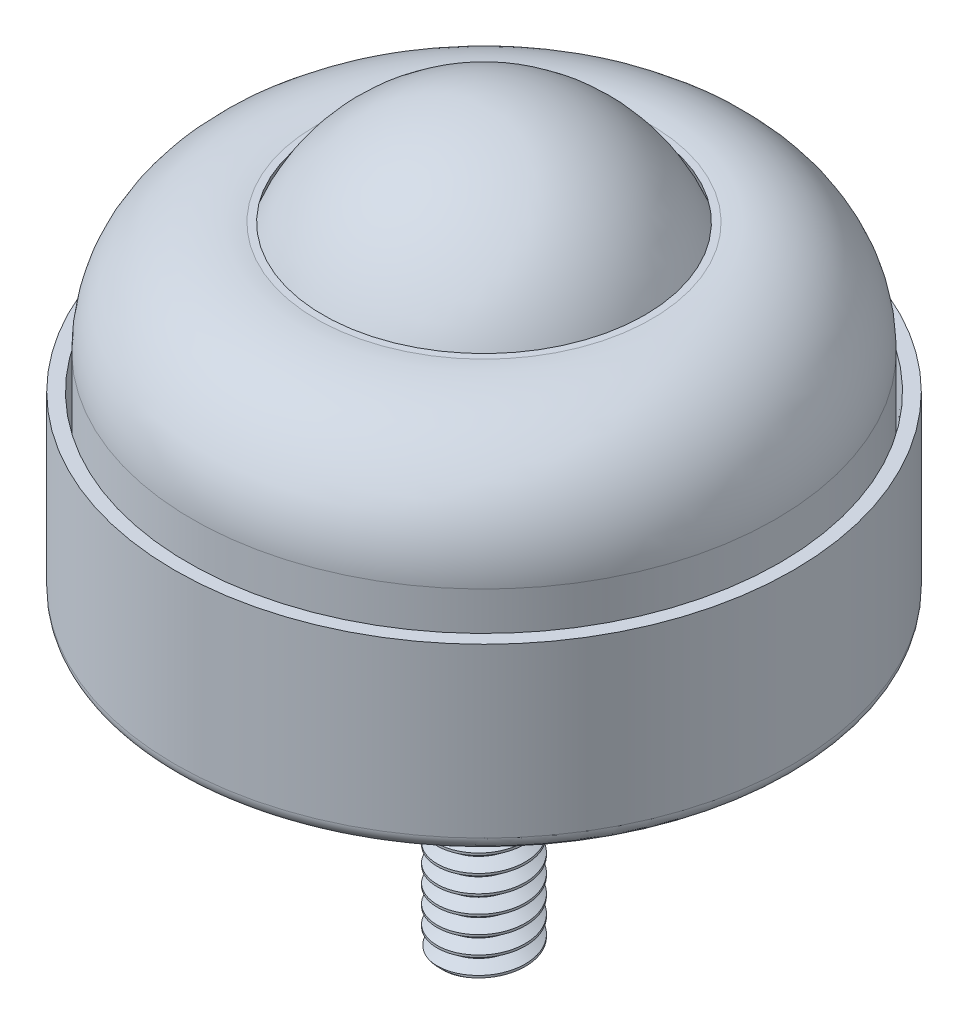
from build123d import *

# Parameters (mm, degrees)
SKETCH4_W           = 7.14375
SKETCH4_H           = 7.14375
CUT_EXTRUDE1_DEPTH  = 0.9525
SKETCH5_W           = 6.57225
SKETCH5_H           = 6.57225
CUT_EXTRUDE2_DEPTH  = 0.9525
FILLET1_R           = 1.524
FILLET2_R           = 0.1905
SKETCH7_W           = 6.35
SKETCH7_H           = 3.4925
BOSS_EXTRUDE1_DEPTH = 3.175
SKETCH8_OUTSIDE_W   = 79.734
SKETCH8_OUTSIDE_H   = 79.734
SKETCH8_OUTSIDE_R   = 4.041115254
CUT_EXTRUDE3_DEPTH  = 47.96712951
CUT_EXTRUDE3_DRAFT  = -10
FILLET3_R           = 0.127
CUT_SWEEP1_PITCH    = 1.27
CUT_SWEEP1_TO       = 17.5


with BuildPart() as part:
    # Sketch3 → Revolve1 (revolve)
    with BuildSketch(Plane.XY, mode=Mode.PRIVATE) as revolve1_sk:
        with BuildLine():
            ThreePointArc((20.955, 19.7485), (18.288003578, 25.737218359), (12.052584365, 27.761363795))
            Line((12.052584365, 27.761363795), (0, 27.761363795))
            Line((0, 27.761363795), (0, 1.5875))
            Line((0, 1.5875), (3.175, 1.5875))
            Line((3.175, 1.5875), (17.85, 1.5875))
            Line((17.85, 1.5875), (20.39, 4.1275))
            Line((20.39, 4.1275), (21.209, 4.1275))
            ThreePointArc((21.209, 4.1275), (21.92742049, 4.42507951), (22.225, 5.1435))
            Line((22.225, 5.1435), (22.225, 17.2085))
            Line((22.225, 17.2085), (21.2725, 17.2085))
            Line((21.2725, 17.2085), (20.955, 11.176))
            Line((20.955, 11.176), (20.955, 17.2085))
            Line((20.955, 17.2085), (20.955, 19.7485))
        make_face()
    revolve(revolve1_sk.sketch.rotate(Axis((0, 34.9, 0), (0, -1, 0)), 180), axis=Axis((0, 34.9, 0), (0, -1, 0)))

    # Sketch4 → Cut-Extrude1 (cut)
    with BuildSketch(Plane.XZ.offset(-1.5875)):
        Rectangle(SKETCH4_W, SKETCH4_H)
    extrude(amount=-CUT_EXTRUDE1_DEPTH, mode=Mode.SUBTRACT)

    # Sketch5 → Cut-Extrude2 (cut)
    with BuildSketch(Plane.XZ.offset(-2.54)):
        Rectangle(SKETCH5_W, SKETCH5_H)
    extrude(amount=-CUT_EXTRUDE2_DEPTH, mode=Mode.SUBTRACT)

    # Fillet1
    fillet1_edges = [part.edges().sort_by_distance(p)[0] for p in [
        (20.39, 4.1275, 0),
        (17.85, 1.5875, 0),
    ]]
    fillet(fillet1_edges, radius=FILLET1_R)

    # Fillet2
    fillet2_edges = [part.edges().sort_by_distance(p)[0] for p in [
        (-3.571875, 2.54, 0),
        (-3.571875, 2.06375, -3.571875),
        (0, 2.54, 3.571875),
        (-3.571875, 2.06375, 3.571875),
        (3.571875, 2.54, 0),
        (3.571875, 2.06375, 3.571875),
        (0, 2.54, -3.571875),
        (3.571875, 2.06375, -3.571875),
        (-3.571875, 1.5875, 0),
        (0, 1.5875, -3.571875),
        (3.571875, 1.5875, 0),
        (0, 1.5875, 3.571875),
        (-3.286125, 3.01625, -3.286125),
        (-3.286125, 3.01625, 3.286125),
        (3.286125, 3.01625, 3.286125),
        (3.286125, 3.01625, -3.286125),
    ]]
    fillet(fillet2_edges, radius=FILLET2_R)

    # Indent1: read off the stored shape, not the designer's step
    # Indent1 outline → Indent1 (revolve, cut)
    with BuildSketch(Plane.XY):
        with BuildLine():
            Line((0, 27.761363807), (0, 9.373))
            ThreePointArc((0, 9.373), (10.859731639, 15.373715672), (11.558683386, 27.761363807))
            Line((11.558683386, 27.761363807), (0, 27.761363807))
        make_face()
    revolve(axis=Axis((0, 0, 0), (0, 1, 0)), mode=Mode.SUBTRACT)


with BuildPart() as body_2:
    # Sketch6 → Revolve2 (revolve)
    with BuildSketch(Plane.XY):
        with BuildLine():
            Line((0, 34.9), (0, 9.5))
            ThreePointArc((0, 9.5), (12.7, 22.2), (0, 34.9))
        make_face()
    revolve(axis=Axis((0, 27.761363795, 0), (0, -1, 0)))


with BuildPart() as body_3:
    # Revolve3: read off the stored shape, not the designer's step
    # Revolve3 outline → Revolve3 (revolve)
    with BuildSketch(Plane.XY):
        Polygon((3.175, 1.5875), (0, 1.5875), (0, -17.5), (2.7559, -17.5), (3.175, -17.0809), align=None)
    revolve(axis=Axis((0, 0, 0), (0, 1, 0)))


with BuildPart() as body_4:
    # Sketch7 → Boss-Extrude1 (new, symmetric)
    with BuildSketch(Plane.XY):
        with Locations((0, 1.74625)):
            Rectangle(SKETCH7_W, SKETCH7_H)
    extrude(amount=BOSS_EXTRUDE1_DEPTH, both=True)


with BuildPart() as cut_extrude3_tool:
    # Sketch8 outside → Cut-Extrude3 (with draft: the straight prism first)
    with BuildSketch(Plane.XZ):
        Rectangle(SKETCH8_OUTSIDE_W, SKETCH8_OUTSIDE_H)
        Circle(SKETCH8_OUTSIDE_R, mode=Mode.SUBTRACT)
    extrude(amount=-CUT_EXTRUDE3_DEPTH)
    # Cut-Extrude3: the draft: its side faces are tilted about the plane it starts from
    cut_extrude3_sides = [cut_extrude3_tool.faces().sort_by_distance(p)[0] for p in [
        (0, 23.983564755, -39.867),
        (39.867, 23.983564755, 0),
        (0, 23.983564755, 39.867),
        (-39.867, 23.983564755, 0),
        (-4.041115254, 23.983564755, 0),
    ]]
    draft(cut_extrude3_sides, Plane.XZ, CUT_EXTRUDE3_DRAFT)


with BuildPart() as body_4_1:
    add(body_4.part)

    # Cut-Extrude3: cut by cut_extrude3_tool
    add(cut_extrude3_tool.part, mode=Mode.SUBTRACT)

    # Fillet3
    fillet3_edges = [body_4_1.edges().sort_by_distance(p)[0] for p in [
        (0, 0, 3.175),
        (3.175, 0, 0),
        (0, 0, -3.175),
        (-3.175, 0, 0),
        (-2.8575, 0, 2.8575),
        (2.8575, 0, 2.8575),
        (2.8575, 0, -2.8575),
        (-2.8575, 0, -2.8575),
    ]]
    fillet(fillet3_edges, radius=FILLET3_R)


with BuildPart() as body_3_1:
    add(body_3.part)

    # Combine1: union part, body 4
    add(part.part)
    add(body_4_1.part)


with BuildPart() as body_3_2:
    # Split1: the piece on the far side of the plane
    add(body_3_1.part)
    split(bisect_by=Plane.ZX, keep=Keep.BOTTOM)

    # Cut-Sweep1: arcs per turn and ends read off the stored shape
    # Cut-Sweep1: the profile of Sketch10 screwed along a right-hand helix through 14.779528 turns, 8 arcs to a turn; built about Z, then put on its axis
    cut_sweep1_z = Axis((0, 0, 0), (0, 0, 1))
    cut_sweep1_corners = [(2.350110803, 0, -0.635), (2.350110803, 0, -0.47625), (3.209370383, 0, 0.01984375), (3.209370383, 0, -1.13109375)]
    with BuildLine(mode=Mode.PRIVATE) as cut_sweep1_profile:
        Line(cut_sweep1_corners[0], cut_sweep1_corners[1])
        Line(cut_sweep1_corners[1], cut_sweep1_corners[2])
        Line(cut_sweep1_corners[2], cut_sweep1_corners[3])
        Line(cut_sweep1_corners[3], cut_sweep1_corners[0])
    cut_sweep1_cap = Face(cut_sweep1_profile.wire())
    cut_sweep1_turn_angles = [0, 22.5, 45, 67.5, 90, 112.5, 135, 157.5, 180, 202.5, 225, 247.5, 270, 292.5, 315, 337.5, 360]
    cut_sweep1_turn_weights = [1, 0.9238795325112867, 1, 0.9238795325112867, 1, 0.9238795325112867, 1, 0.9238795325112867, 1, 0.9238795325112867, 1, 0.9238795325112867, 1, 0.9238795325112867, 1, 0.9238795325112867, 1]
    cut_sweep1_turn_rails = [Edge.make_bspline([Vector(p[0], p[1], 0).rotate(cut_sweep1_z, cut_sweep1_turn_angles[k]) / cut_sweep1_turn_weights[k] + Vector(0, 0, p[2] + CUT_SWEEP1_PITCH * cut_sweep1_turn_angles[k] / 360) for k in range(17)], [0, 0, 0, 1, 1, 2, 2, 3, 3, 4, 4, 5, 5, 6, 6, 7, 7, 8, 8, 8], 2, cut_sweep1_turn_weights) for p in cut_sweep1_corners]
    cut_sweep1_turn_sides = [Face.make_surface_from_curves(cut_sweep1_turn_rails[p[0]], cut_sweep1_turn_rails[p[1]]) for p in [(0, 1), (1, 2), (2, 3), (3, 0)]]
    cut_sweep1_last_angles = [5040, 5062.5, 5085, 5107.5, 5130, 5152.5, 5175, 5197.5, 5220, 5242.5, 5265, 5287.5, 5310, 5315.31496063, 5320.62992126]
    cut_sweep1_last_weights = [1, 0.9238795325112867, 1, 0.9238795325112867, 1, 0.9238795325112867, 1, 0.9238795325112867, 1, 0.9238795325112867, 1, 0.9238795325112867, 1, 0.9957005451488364, 1]
    cut_sweep1_last_rails = [Edge.make_bspline([Vector(p[0], p[1], 0).rotate(cut_sweep1_z, cut_sweep1_last_angles[k]) / cut_sweep1_last_weights[k] + Vector(0, 0, p[2] + CUT_SWEEP1_PITCH * cut_sweep1_last_angles[k] / 360) for k in range(15)], [0, 0, 0, 1, 1, 2, 2, 3, 3, 4, 4, 5, 5, 6, 6, 7, 7, 7], 2, cut_sweep1_last_weights) for p in cut_sweep1_corners]
    cut_sweep1_last_sides = [Face.make_surface_from_curves(cut_sweep1_last_rails[p[0]], cut_sweep1_last_rails[p[1]]) for p in [(0, 1), (1, 2), (2, 3), (3, 0)]]
    cut_sweep1 = Plane(origin=(0, -17.5, 0), x_dir=(-1, 0, 0), z_dir=(0, 1, 0)) * split(Solid(Shell([*[p.moved(Location((0, 0, CUT_SWEEP1_PITCH * i))) for i in range(14) for p in cut_sweep1_turn_sides], *cut_sweep1_last_sides, cut_sweep1_cap, cut_sweep1_cap.rotate(cut_sweep1_z, 5320.62992126).moved(Location((0, 0, CUT_SWEEP1_PITCH * 5320.62992126 / 360)))])), bisect_by=Plane.XY.offset(CUT_SWEEP1_TO), keep=Keep.BOTTOM, mode=Mode.PRIVATE)
    add(cut_sweep1, mode=Mode.SUBTRACT)


with BuildPart() as body_3_3:
    add(body_3_1.part)

    # Split1
    split(bisect_by=Plane.ZX, keep=Keep.TOP)

    add(body_3_2.part)  # Boss-Extrude2 merges body 3 2
    # Boss-Extrude2: read off the stored shape, not the designer's step
    # Boss-Extrude2 outline → Boss-Extrude2 (revolve)
    with BuildSketch(Plane.XY):
        Polygon((2.350104501, 0), (2.350104501, -0.824895499), (3.175, 0), align=None)
    revolve(axis=Axis((0, 0, 0), (0, 1, 0)))


solid = Compound([body_2.part, body_3_3.part])
